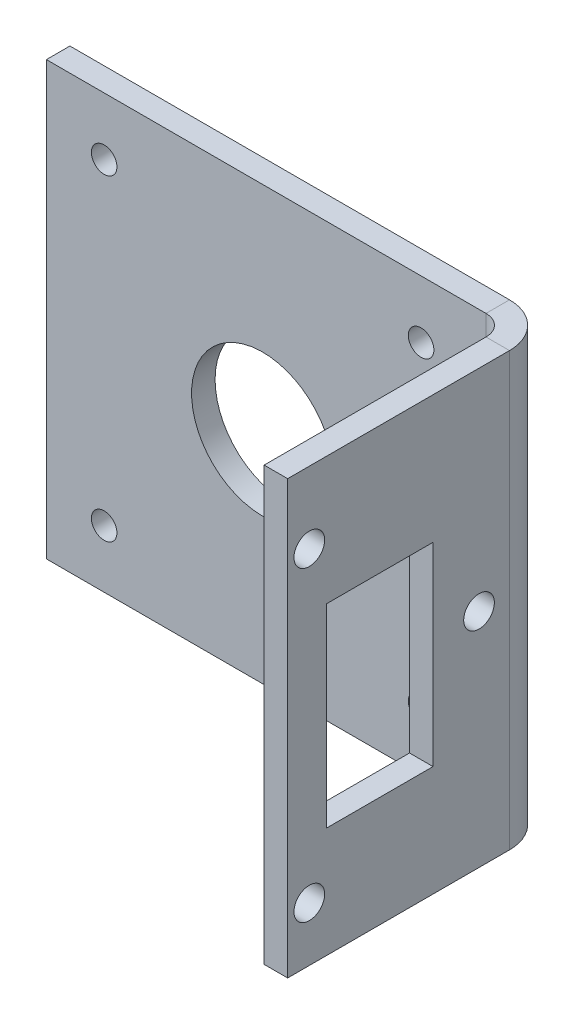
from build123d import *

# Parameters (mm, degrees)
SKETCH1_W                    = 47.3
SKETCH1_H                    = 42.3
BASE_FLANGE1_DEPTH           = 2.3
EDGE_FLANGE1_STRIP_W         = 13.2
EDGE_FLANGE1_STRIP_H         = 2.3
EDGE_FLANGE1_STRIP_CUT_DEPTH = 42.3
EDGE_FLANGE1_DEPTH           = 42.3
SKETCH9_W                    = 10.4
SKETCH9_H                    = 19
CUT_EXTRUDE1_DEPTH           = 3
SKETCH10_R                   = 1.5
CUT_EXTRUDE2_DEPTH           = 3
SKETCH11_R                   = 1.25
CUT_EXTRUDE5_DEPTH           = 3
SKETCH22_R                   = 6.95
CUT_EXTRUDE6_DEPTH           = 3


# Sheet-metal steps are written as plain solids
with BuildPart() as part:
    # Sketch1 → Base-Flange1 (new body)
    with BuildSketch(Plane.XY):
        with Locations((23.65, 21.15)):
            Rectangle(SKETCH1_W, SKETCH1_H)
    extrude(amount=-BASE_FLANGE1_DEPTH)

    # Edge-Flange1 strip (across the edge) → Edge-Flange1 strip cut (cut)
    with BuildSketch(Plane(origin=(47.3, 0, 0), x_dir=(-1, 0, 0), z_dir=(0, 1, 0))):
        with Locations((-2.3, -1.15)):
            Rectangle(EDGE_FLANGE1_STRIP_W, EDGE_FLANGE1_STRIP_H)
    extrude(amount=EDGE_FLANGE1_STRIP_CUT_DEPTH, mode=Mode.SUBTRACT)

    # Edge-Flange1 section (across the edge) → Edge-Flange1 (add)
    with BuildSketch(Plane(origin=(47.3, 0, 0), x_dir=(-1, 0, 0), z_dir=(0, 1, 0))):
        with BuildLine():
            Line((0, 2), (0, 23.7))
            Line((0, 23.7), (2.3, 23.7))
            Line((2.3, 23.7), (2.3, 2))
            ThreePointArc((2.3, 2), (2.885786438, 0.585786438), (4.3, 0))
            Line((4.3, 0), (4.3, -2.3))
            ThreePointArc((4.3, -2.3), (1.259440841, -1.040559159), (0, 2))
        make_face()
    extrude(amount=EDGE_FLANGE1_DEPTH)

    # Sketch9 → Cut-Extrude1 (cut)
    with BuildSketch(Plane(origin=(47.3, -232.998028616, -457.703147412), x_dir=(0, 0, -1), z_dir=(1, 0, 0))):
        with Locations((-472.38476551, 253.298028616)):
            Rectangle(SKETCH9_W, SKETCH9_H)
    extrude(amount=-CUT_EXTRUDE1_DEPTH, mode=Mode.SUBTRACT)

    # Sketch10 → Cut-Extrude2 (cut)
    with BuildSketch(Plane(origin=(47.3, -232.998028616, -457.703147412), x_dir=(0, 0, -1), z_dir=(1, 0, 0))):
        with Locations((-479.28476551, 268.298028616)):
            Circle(SKETCH10_R)
        with Locations((-462.68476551, 254.698028616)):
            Circle(SKETCH10_R)
        with Locations((-479.28476551, 238.298028616)):
            Circle(SKETCH10_R)
    extrude(amount=-CUT_EXTRUDE2_DEPTH, mode=Mode.SUBTRACT)

    # Sketch11 → Cut-Extrude5 (cut)
    with BuildSketch(Plane.XY):
        with Locations((5.65, 5.65)):
            Circle(SKETCH11_R)
        with Locations((5.65, 36.65)):
            Circle(SKETCH11_R)
        with Locations((36.65, 5.65)):
            Circle(SKETCH11_R)
        with Locations((36.65, 36.65)):
            Circle(SKETCH11_R)
    extrude(amount=-CUT_EXTRUDE5_DEPTH, mode=Mode.SUBTRACT)

    # Sketch22 → Cut-Extrude6 (cut)
    with BuildSketch(Plane.XY):
        with Locations((21.15, 21.15)):
            Circle(SKETCH22_R)
    extrude(amount=-CUT_EXTRUDE6_DEPTH, mode=Mode.SUBTRACT)


solid = part.part
